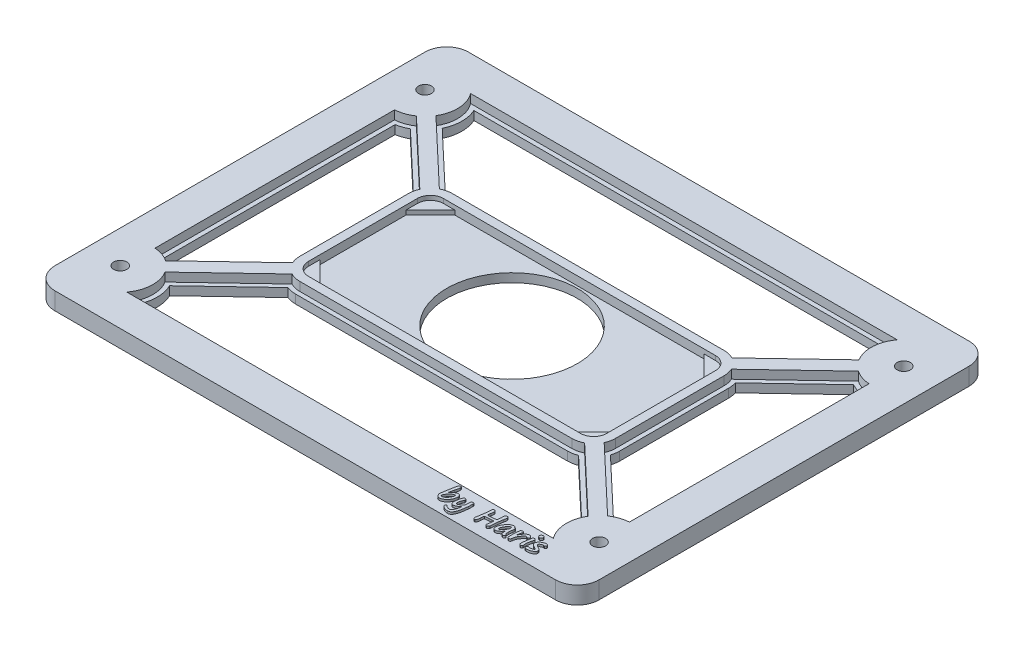
from build123d import *

# Parameters (mm, degrees)
SKETCH1_R           = 1.5
BOSS_EXTRUDE1_DEPTH = 4
CUT_EXTRUDE1_DEPTH  = 2
BOSS_EXTRUDE5_START = 1
BOSS_EXTRUDE5_DEPTH = 1
BOSS_EXTRUDE6_DEPTH = 2
CUT_EXTRUDE2_DEPTH  = 5
SKETCH9_R           = 15
CUT_EXTRUDE3_DEPTH  = 5
BOSS_EXTRUDE4_DEPTH = 0.5


with BuildPart() as part:
    # Sketch1 → Boss-Extrude1 (new body)
    with BuildSketch(Plane(origin=(0, 30, 0), x_dir=(1, 0, 0), z_dir=(0, 1, 0))):
        with BuildLine():
            Line((-57.5, 47.5), (57.5, 47.5))
            ThreePointArc((57.5, 47.5), (61.035533906, 46.035533906), (62.5, 42.5))
            Line((62.5, 42.5), (62.5, -42.5))
            ThreePointArc((62.5, -42.5), (61.035533906, -46.035533906), (57.5, -47.5))
            Line((57.5, -47.5), (-57.5, -47.5))
            ThreePointArc((-57.5, -47.5), (-61.035533906, -46.035533906), (-62.5, -42.5))
            Line((-62.5, -42.5), (-62.5, 42.5))
            ThreePointArc((-62.5, 42.5), (-61.035533906, 46.035533906), (-57.5, 47.5))
        make_face()
        with Locations((-55, -35)):
            Circle(SKETCH1_R, mode=Mode.SUBTRACT)
        with Locations((55, -35)):
            Circle(SKETCH1_R, mode=Mode.SUBTRACT)
        with Locations((55, 35)):
            Circle(SKETCH1_R, mode=Mode.SUBTRACT)
        with Locations((-55, 35)):
            Circle(SKETCH1_R, mode=Mode.SUBTRACT)
    extrude(amount=BOSS_EXTRUDE1_DEPTH)

    # Arduino_Cutout → Cut-Extrude1 (cut)
    # profile 1 of 2: a face of its own
    with BuildSketch(Plane(origin=(0, 34, 0), x_dir=(1, 0, 0), z_dir=(0, 1, 0))):
        with BuildLine():
            ThreePointArc((-54.5, -27.516685226), (-48.183662403, -31.871495284), (-49, -39.5))
            Line((-49, -39.5), (49, -39.5))
            ThreePointArc((49, -39.5), (48.183662403, -31.871495284), (54.5, -27.516685226))
            Line((54.5, -27.516685226), (54.5, 27.516685226))
            ThreePointArc((54.5, 27.516685226), (48.183662403, 31.871495284), (49, 39.5))
            Line((49, 39.5), (-49, 39.5))
            ThreePointArc((-49, 39.5), (-48.183662403, 31.871495284), (-54.5, 27.516685226))
            Line((-54.5, 27.516685226), (-54.5, -27.516685226))
        make_face()
        with BuildLine():
            ThreePointArc((-36.25, 12.5), (-34.785533906, 16.035533906), (-31.25, 17.5))
            Line((-31.25, 17.5), (31.25, 17.5))
            ThreePointArc((31.25, 17.5), (34.785533906, 16.035533906), (36.25, 12.5))
            Line((36.25, 12.5), (36.25, -12.5))
            ThreePointArc((36.25, -12.5), (34.785533906, -16.035533906), (31.25, -17.5))
            Line((31.25, -17.5), (-31.25, -17.5))
            ThreePointArc((-31.25, -17.5), (-34.785533906, -16.035533906), (-36.25, -12.5))
            Line((-36.25, -12.5), (-36.25, 12.5))
        make_face(mode=Mode.SUBTRACT)
    # profile 2 of 2: a face of its own
    with BuildSketch(Plane(origin=(0, 34, 0), x_dir=(1, 0, 0), z_dir=(0, 1, 0))):
        with BuildLine():
            Line((31.25, 15.5), (-31.25, 15.5))
            ThreePointArc((-31.25, 15.5), (-33.371320344, 14.621320344), (-34.25, 12.5))
            Line((-34.25, 12.5), (-34.25, -12.5))
            ThreePointArc((-34.25, -12.5), (-33.371320344, -14.621320344), (-31.25, -15.5))
            Line((-31.25, -15.5), (31.25, -15.5))
            ThreePointArc((31.25, -15.5), (33.371320344, -14.621320344), (34.25, -12.5))
            Line((34.25, -12.5), (34.25, 12.5))
            ThreePointArc((34.25, 12.5), (33.371320344, 14.621320344), (31.25, 15.5))
        make_face()
    extrude(amount=-CUT_EXTRUDE1_DEPTH, mode=Mode.SUBTRACT)


with BuildPart() as boss_extrude5_tool:
    # Sketch6 → Boss-Extrude5 (new body)
    with BuildSketch(Plane(origin=(0, 32, 0), x_dir=(1, 0, 0), z_dir=(0, 1, 0)).offset(BOSS_EXTRUDE5_START)):
        with BuildLine():
            Line((28.639875998, -15.5), (34.25, -9.889875998))
            Line((34.25, -9.889875998), (34.25, -12.5))
            ThreePointArc((34.25, -12.5), (33.371320344, -14.621320344), (31.25, -15.5))
            Line((31.25, -15.5), (28.639875998, -15.5))
        make_face()
        with BuildLine():
            Line((28.639875998, 15.5), (34.25, 9.889875998))
            Line((34.25, 9.889875998), (34.249992072, 12.506896859))
            ThreePointArc((34.249992072, 12.506896859), (33.368880533, 14.623757352), (31.25, 15.5))
            Line((31.25, 15.5), (28.639875998, 15.5))
        make_face()
        with BuildLine():
            Line((-34.25, 9.889875998), (-34.249992072, 12.506896859))
            ThreePointArc((-34.249992072, 12.506896859), (-33.368880533, 14.623757352), (-31.25, 15.5))
            Line((-31.25, 15.5), (-28.639875998, 15.5))
            Line((-28.639875998, 15.5), (-34.25, 9.889875998))
        make_face()
        with BuildLine():
            Line((-28.639875998, -15.5), (-34.25, -9.889875998))
            Line((-34.25, -9.889875998), (-34.25, -12.5))
            ThreePointArc((-34.25, -12.5), (-33.371320344, -14.621320344), (-31.25, -15.5))
            Line((-31.25, -15.5), (-28.639875998, -15.5))
        make_face()
    extrude(amount=-BOSS_EXTRUDE5_DEPTH)


with BuildPart() as part_1:
    add(part.part)


with BuildPart() as part_2:
    # Boss-Extrude5: joined with boss_extrude5_tool
    add(part_1.part.fuse(boss_extrude5_tool.part, tol=0.00001))

    # Sketch11 → Boss-Extrude6 (add)
    with BuildSketch(Plane(origin=(0, 32, 0), x_dir=(1, 0, 0), z_dir=(0, 1, 0))):
        Polygon((-50.770307362, 28.806479177), (-35.783638682, 14.608582533), (-33.600386983, 16.913125993), (-48.587055663, 31.111022637), align=None)
        Polygon((48.587055663, 31.111022637), (33.600386983, 16.913125993), (35.783638682, 14.608582533), (50.770307362, 28.806479177), align=None)
        Polygon((-48.587055663, -31.111022637), (-33.600386983, -16.913125993), (-35.783638682, -14.608582533), (-50.770307362, -28.806479177), align=None)
        Polygon((50.770307362, -28.806479177), (48.587055663, -31.111022637), (33.600386983, -16.913125993), (35.783638682, -14.608582533), align=None)
    extrude(amount=BOSS_EXTRUDE6_DEPTH)

    # Sketch8 → Cut-Extrude2 (cut)
    with BuildSketch(Plane(origin=(0, 32, 0), x_dir=(1, 0, 0), z_dir=(0, 1, 0))):
        with BuildLine():
            Line((47.342828007, -31.309780892), (33.400583169, -18.101338414))
            ThreePointArc((33.400583169, -18.101338414), (32.34361088, -18.399492795), (31.25, -18.5))
            Line((31.25, -18.5), (-31.25, -18.5))
            ThreePointArc((-31.25, -18.5), (-32.34361088, -18.399492795), (-33.400583169, -18.101338414))
            Line((-33.400583169, -18.101338414), (-47.342828007, -31.309780892))
            ThreePointArc((-47.342828007, -31.309780892), (-46.500648081, -34.895038331), (-47.254033308, -38.5))
            Line((-47.254033308, -38.5), (47.254033308, -38.5))
            ThreePointArc((47.254033308, -38.5), (46.500648081, -34.895038331), (47.342828007, -31.309780892))
        make_face()
        with BuildLine():
            Line((-50.901569002, -27.553332064), (-36.959324164, -14.344889586))
            ThreePointArc((-36.959324164, -14.344889586), (-37.176885564, -13.433824131), (-37.25, -12.5))
            Line((-37.25, -12.5), (-37.25, 12.5))
            ThreePointArc((-37.25, 12.5), (-37.176885564, 13.433824131), (-36.959324164, 14.344889586))
            Line((-36.959324164, 14.344889586), (-50.901569002, 27.553332064))
            ThreePointArc((-50.901569002, 27.553332064), (-52.163245467, 26.987333545), (-53.5, 26.633399735))
            Line((-53.5, 26.633399735), (-53.5, -26.633399735))
            ThreePointArc((-53.5, -26.633399735), (-52.163245467, -26.987333545), (-50.901569002, -27.553332064))
        make_face()
        with BuildLine():
            Line((36.959324164, -14.344889586), (50.901569002, -27.553332064))
            ThreePointArc((50.901569002, -27.553332064), (52.163245467, -26.987333545), (53.5, -26.633399735))
            Line((53.5, -26.633399735), (53.5, 26.633399735))
            ThreePointArc((53.5, 26.633399735), (52.163245467, 26.987333545), (50.901569002, 27.553332064))
            Line((50.901569002, 27.553332064), (36.959324164, 14.344889586))
            ThreePointArc((36.959324164, 14.344889586), (37.176885564, 13.433824131), (37.25, 12.5))
            Line((37.25, 12.5), (37.25, -12.5))
            ThreePointArc((37.25, -12.5), (37.176885564, -13.433824131), (36.959324164, -14.344889586))
        make_face()
        with BuildLine():
            Line((33.400583169, 18.101338414), (47.342828007, 31.309780892))
            ThreePointArc((47.342828007, 31.309780892), (46.500648081, 34.895038331), (47.254033308, 38.5))
            Line((47.254033308, 38.5), (-47.254033308, 38.5))
            ThreePointArc((-47.254033308, 38.5), (-46.500648081, 34.895038331), (-47.342828007, 31.309780892))
            Line((-47.342828007, 31.309780892), (-33.400583169, 18.101338414))
            ThreePointArc((-33.400583169, 18.101338414), (-32.34361088, 18.399492795), (-31.25, 18.5))
            Line((-31.25, 18.5), (31.25, 18.5))
            ThreePointArc((31.25, 18.5), (32.34361088, 18.399492795), (33.400583169, 18.101338414))
        make_face()
    extrude(amount=-CUT_EXTRUDE2_DEPTH, mode=Mode.SUBTRACT)

    # Sketch9 → Cut-Extrude3 (cut)
    with BuildSketch(Plane(origin=(0, 32, 0), x_dir=(1, 0, 0), z_dir=(0, 1, 0))):
        Circle(SKETCH9_R)
    extrude(amount=-CUT_EXTRUDE3_DEPTH, mode=Mode.SUBTRACT)

    # Sketch10 → Boss-Extrude4 (add)
    # profile 1 of 8: a face of its own
    with BuildSketch(Plane(origin=(0, 34, 0), x_dir=(1, 0, 0), z_dir=(0, 1, 0))):
        with BuildLine():
            add(Edge.make_bspline(
                [(49.600885149, -44.3125), (49.598414738, -44.299928318), (49.592958686, -44.272162991), (49.566149511, -44.233142498), (49.528530972, -44.191710756), (49.476437073, -44.148765787), (49.410404019, -44.10436106), (49.33055765, -44.058203849), (49.237509097, -44.009335869), (49.170193919, -43.977565196), (49.134538995, -43.960737179)],
                knots=[0, 0, 0, 0, 0.507015387, 1.119774364, 1.852261257, 2.745336137, 3.804359101, 5.02806584, 6.425851491, 8, 8, 8, 8], degree=3))
            add(Edge.make_bspline(
                [(49.134538995, -43.960737179), (49.090143126, -43.938687416), (49.004981761, -43.896390959), (48.883773364, -43.833848703), (48.776098618, -43.7718), (48.680924796, -43.712413993), (48.596916566, -43.657283855), (48.527027738, -43.602256048), (48.468665049, -43.550788471), (48.40941023, -43.485178224), (48.353246727, -43.401033022), (48.303239826, -43.29631763), (48.273063252, -43.186222343), (48.269392436, -43.111290342), (48.267551815, -43.073717949)],
                knots=[0, 0, 0, 0, 1.357483612, 2.603962024, 3.734367165, 4.759332248, 5.67627561, 6.483932287, 7.193417315, 7.804498922, 8.89998156, 9.950312991, 10.972246245, 12, 12, 12, 12], degree=3))
            add(Edge.make_bspline(
                [(48.267551815, -43.073717949), (48.26891372, -43.034034641), (48.271620995, -42.955149767), (48.298961543, -42.839540986), (48.340686141, -42.727342827), (48.400753571, -42.619803335), (48.477618596, -42.516326046), (48.569859033, -42.415615702), (48.68104549, -42.32088928), (48.804642587, -42.230238822), (48.936309157, -42.148951847), (49.066648267, -42.073838194), (49.19621673, -42.012610588), (49.322596478, -41.960487248), (49.447554652, -41.920984792), (49.570014843, -41.892999224), (49.690368995, -41.875105963), (49.769896436, -41.872890366), (49.809218482, -41.871794872)],
                knots=[0, 0, 0, 0, 0.895390549, 1.77991135, 2.670078063, 3.59406614, 4.552659087, 5.577920464, 6.673282169, 7.847996523, 9.038730168, 10.168527001, 11.245776762, 12.274762826, 13.256007705, 14.203398491, 15.11167709, 16, 16, 16, 16], degree=3))
            add(Edge.make_bspline(
                [(49.809218482, -41.871794872), (49.845108568, -41.872897806), (49.912616214, -41.874972375), (50.00697597, -41.893499496), (50.088054517, -41.922961315), (50.154519557, -41.96757029), (50.206338468, -42.024694583), (50.242161014, -42.094940613), (50.264145143, -42.176839273), (50.266373143, -42.235692163), (50.267551815, -42.266826923)],
                knots=[0, 0, 0, 0, 1.242964782, 2.337961117, 3.319847325, 4.213556405, 5.085560968, 5.963591422, 6.922685154, 8, 8, 8, 8], degree=3))
            add(Edge.make_bspline(
                [(50.267551815, -42.266826923), (50.266411273, -42.284136823), (50.264121313, -42.318891333), (50.242009709, -42.368463394), (50.208239796, -42.414789449), (50.163673122, -42.45609336), (50.114875037, -42.49019713), (50.068660038, -42.517901757), (50.024975978, -42.534049217), (49.996815083, -42.53707407), (49.983897969, -42.538461538)],
                knots=[0, 0, 0, 0, 0.97699526, 1.961593711, 3.02517148, 4.214528751, 5.387275293, 6.398091366, 7.265220967, 8, 8, 8, 8], degree=3))
            add(Edge.make_bspline(
                [(49.983897969, -42.538461538), (49.978005461, -42.538050229), (49.963952238, -42.537069285), (49.940160077, -42.531752585), (49.910492443, -42.523731779), (49.889046223, -42.516675982), (49.877327456, -42.512820513)],
                knots=[0, 0, 0, 0, 0.644110285, 1.536158334, 2.653693559, 4, 4, 4, 4], degree=3))
            add(Edge.make_bspline(
                [(49.877327456, -42.512820513), (49.855097302, -42.505412281), (49.816959696, -42.492702867), (49.777005457, -42.488805221), (49.760340277, -42.487179487)],
                knots=[0, 0, 0, 0, 1.165786607, 2, 2, 2, 2], degree=3))
            add(Edge.make_bspline(
                [(49.760340277, -42.487179487), (49.718790334, -42.489459403), (49.632591133, -42.4941893), (49.500749899, -42.525679235), (49.363449992, -42.577020367), (49.248542202, -42.634281733), (49.158717348, -42.686876549), (49.099638264, -42.730389143), (49.048382703, -42.774082105), (49.006799741, -42.820345466), (48.974165811, -42.86844488), (48.951709329, -42.918706436), (48.937029938, -42.970332436), (48.935160461, -43.005511431), (48.934218482, -43.023237179)],
                knots=[0, 0, 0, 0, 1.407632196, 2.920263242, 4.569449818, 6.366406994, 7.263471623, 8.092497508, 8.84932721, 9.541498029, 10.194082936, 10.809730306, 11.400255161, 12, 12, 12, 12], degree=3))
            add(Edge.make_bspline(
                [(48.934218482, -43.023237179), (48.935487046, -43.040772911), (48.938079602, -43.07661059), (48.958922713, -43.128675259), (48.991336707, -43.179532204), (49.028247316, -43.220166955), (49.066418787, -43.252617437), (49.102024616, -43.279333318), (49.144362366, -43.307996287), (49.194053736, -43.336621287), (49.249120409, -43.36950246), (49.311894031, -43.401702244), (49.380724944, -43.436325808), (49.429093031, -43.459237091), (49.454250533, -43.471153846)],
                knots=[0, 0, 0, 0, 0.875474263, 1.789201934, 2.768354177, 3.885199607, 4.52028356, 5.274241631, 6.112168998, 7.077351017, 8.143524944, 9.321499989, 10.606842341, 12, 12, 12, 12], degree=3))
            add(Edge.make_bspline(
                [(49.454250533, -43.471153846), (49.491451732, -43.489428746), (49.563074759, -43.524613193), (49.665072028, -43.577787162), (49.756115163, -43.631223272), (49.838837793, -43.681087733), (49.910278161, -43.731597005), (49.972855086, -43.779632251), (50.02514751, -43.826532646), (50.080136983, -43.886981728), (50.134895057, -43.964278587), (50.182053933, -44.062820687), (50.210565938, -44.166963323), (50.214353946, -44.238073739), (50.216269764, -44.274038462)],
                knots=[0, 0, 0, 0, 1.27151207, 2.448027098, 3.527344007, 4.509652556, 5.409792129, 6.20962247, 6.928887115, 7.561069154, 8.713601741, 9.820434099, 10.897665249, 12, 12, 12, 12], degree=3))
            add(Edge.make_bspline(
                [(50.216269764, -44.274038462), (50.21484821, -44.306793401), (50.212032257, -44.371677573), (50.185584843, -44.466593073), (50.143563822, -44.556938391), (50.084578401, -44.643004551), (50.008929243, -44.724303281), (49.916662384, -44.801019352), (49.808424034, -44.874119735), (49.685447321, -44.941519088), (49.55257224, -45.003137424), (49.413518673, -45.056791874), (49.270633157, -45.102479751), (49.123840765, -45.140392602), (48.972817851, -45.168992975), (48.817685289, -45.189731935), (48.65854471, -45.203072171), (48.550965047, -45.204438992), (48.496718482, -45.205128205)],
                knots=[0, 0, 0, 0, 0.737647673, 1.46120433, 2.205321861, 2.977507412, 3.80486027, 4.702969019, 5.67906423, 6.747245838, 7.863422134, 8.981386367, 10.10768365, 11.246246574, 12.399733899, 13.573273878, 14.776334184, 16, 16, 16, 16], degree=3))
            add(Edge.make_bspline(
                [(48.496718482, -45.205128205), (48.458711272, -45.204230738), (48.387346453, -45.202545595), (48.287921962, -45.185672383), (48.202839178, -45.159360766), (48.132700536, -45.120350603), (48.076790316, -45.06997701), (48.038481401, -45.006313126), (48.014271717, -44.932533716), (48.012215538, -44.879475876), (48.011141559, -44.851762821)],
                knots=[0, 0, 0, 0, 1.334045999, 2.504891855, 3.531580528, 4.447545952, 5.304102635, 6.142582961, 7.029837979, 8, 8, 8, 8], degree=3))
            add(Edge.make_bspline(
                [(48.011141559, -44.851762821), (48.012309589, -44.830769548), (48.01460819, -44.789456241), (48.03494043, -44.730267664), (48.067808628, -44.676237573), (48.112708161, -44.629181976), (48.164645549, -44.589491538), (48.221352502, -44.560380371), (48.281038788, -44.541356912), (48.322165225, -44.539431154), (48.342872328, -44.538461538)],
                knots=[0, 0, 0, 0, 0.997844758, 1.96368944, 2.945829432, 3.990302125, 5.044037246, 6.045769726, 7.016047788, 8, 8, 8, 8], degree=3))
            add(Edge.make_bspline(
                [(48.342872328, -44.538461538), (48.352501642, -44.538841404), (48.374520199, -44.53971001), (48.410795852, -44.545183442), (48.454531498, -44.551962124), (48.485546779, -44.559320218), (48.502327456, -44.563301282)],
                knots=[0, 0, 0, 0, 0.71493734, 1.634788241, 2.720312856, 4, 4, 4, 4], degree=3))
            add(Edge.make_bspline(
                [(48.502327456, -44.563301282), (48.536903279, -44.57111114), (48.602629934, -44.585957233), (48.669943667, -44.588526092), (48.701846687, -44.58974359)],
                knots=[0, 0, 0, 0, 1.05210962, 2, 2, 2, 2], degree=3))
            add(Edge.make_bspline(
                [(48.701846687, -44.58974359), (48.744625357, -44.588843645), (48.831779858, -44.587010157), (48.963489345, -44.570917142), (49.098406355, -44.545956612), (49.210917877, -44.517213693), (49.298941595, -44.489722126), (49.359643253, -44.468181465), (49.414978239, -44.446194541), (49.463274337, -44.420780897), (49.507234398, -44.396727827), (49.544010308, -44.36974362), (49.576207601, -44.343074332), (49.5928965, -44.322397564), (49.600885149, -44.3125)],
                knots=[0, 0, 0, 0, 1.599371766, 3.258456852, 4.955126155, 6.728569823, 7.597387722, 8.403040565, 9.137626545, 9.821128873, 10.443102821, 11.008610245, 11.525441154, 12, 12, 12, 12], degree=3))
        make_face()
    # profile 2 of 8: a face of its own
    with BuildSketch(Plane(origin=(0, 34, 0), x_dir=(1, 0, 0), z_dir=(0, 1, 0))):
        with BuildLine():
            add(Edge.make_bspline(
                [(48.216269764, -40.991987179), (48.214372496, -41.022468368), (48.210585454, -41.083310355), (48.176068009, -41.170720752), (48.120798987, -41.251368858), (48.047446101, -41.321497458), (47.96876427, -41.38135948), (47.891905727, -41.425883767), (47.820372128, -41.455467316), (47.773383814, -41.459610957), (47.751526174, -41.461538462)],
                knots=[0, 0, 0, 0, 1.020633984, 2.037236793, 3.10987328, 4.283687933, 5.430439738, 6.423201178, 7.266517617, 8, 8, 8, 8], degree=3))
            add(Edge.make_bspline(
                [(47.751526174, -41.461538462), (47.72539536, -41.460128857), (47.673503203, -41.457329578), (47.598813127, -41.430457291), (47.528594086, -41.388970531), (47.466472737, -41.331724909), (47.414429436, -41.26724985), (47.374518815, -41.200726664), (47.349675001, -41.133380026), (47.346171881, -41.087789964), (47.344474892, -41.065705128)],
                knots=[0, 0, 0, 0, 1.008582021, 2.002903408, 3.03704176, 4.15024144, 5.253498622, 6.236240751, 7.145595932, 8, 8, 8, 8], degree=3))
            add(Edge.make_bspline(
                [(47.344474892, -41.065705128), (47.346020261, -41.035386225), (47.348993405, -40.977055514), (47.371695916, -40.893700648), (47.411315132, -40.820434232), (47.464571817, -40.7557358), (47.533852963, -40.704102396), (47.616962774, -40.667013375), (47.712946101, -40.644372016), (47.781308228, -40.642178365), (47.817231303, -40.641025641)],
                knots=[0, 0, 0, 0, 1.012698287, 1.948335972, 2.858894459, 3.777859821, 4.72769898, 5.718440003, 6.801081042, 8, 8, 8, 8], degree=3))
            add(Edge.make_bspline(
                [(47.817231303, -40.641025641), (47.845647048, -40.642188502), (47.900514611, -40.644433854), (47.978679047, -40.66355521), (48.047721606, -40.697357189), (48.106816492, -40.742972305), (48.15463153, -40.797480996), (48.191368284, -40.857178712), (48.211858818, -40.923397046), (48.214784249, -40.968887436), (48.216269764, -40.991987179)],
                knots=[0, 0, 0, 0, 1.15044901, 2.221385842, 3.232987006, 4.243893231, 5.225346676, 6.157089074, 7.064181033, 8, 8, 8, 8], degree=3))
        make_face()
    # profile 3 of 8: a face of its own
    with BuildSketch(Plane(origin=(0, 34, 0), x_dir=(1, 0, 0), z_dir=(0, 1, 0))):
        with BuildLine():
            Line((46.9021672, -43.220352564), (46.9021672, -43.22275641))
            add(Edge.make_bspline(
                [(46.9021672, -43.22275641), (46.908443258, -43.183471891), (46.920274929, -43.109412415), (46.938934712, -43.005539363), (46.951594754, -42.91445241), (46.964615879, -42.83695057), (46.972326071, -42.772355048), (46.980860748, -42.721596625), (46.983663711, -42.683779709), (46.984978479, -42.662927289), (46.985500533, -42.654647436)],
                knots=[0, 0, 0, 0, 1.662261954, 3.133708889, 4.408996323, 5.504397162, 6.416666302, 7.126893436, 7.653316314, 8, 8, 8, 8], degree=3))
            add(Edge.make_bspline(
                [(46.985500533, -42.654647436), (46.986575632, -42.622262737), (46.988651188, -42.55974176), (47.004558157, -42.470075409), (47.031895887, -42.388595137), (47.070090678, -42.316728085), (47.117062048, -42.255367468), (47.175922079, -42.211540199), (47.243413339, -42.184147885), (47.291594045, -42.181072477), (47.316430021, -42.179487179)],
                knots=[0, 0, 0, 0, 1.202991705, 2.322461451, 3.370810698, 4.383210162, 5.33652186, 6.215922066, 7.080351462, 8, 8, 8, 8], degree=3))
            add(Edge.make_bspline(
                [(47.316430021, -42.179487179), (47.345355861, -42.180513208), (47.400229026, -42.182459613), (47.477595394, -42.198293555), (47.545123848, -42.225579308), (47.600950535, -42.26439938), (47.645842499, -42.30887167), (47.678922344, -42.356799026), (47.699842731, -42.408095143), (47.702247078, -42.443724022), (47.703449251, -42.461538462)],
                knots=[0, 0, 0, 0, 1.307088555, 2.47958523, 3.551682151, 4.576762227, 5.53323798, 6.394123767, 7.197061883, 8, 8, 8, 8], degree=3))
            add(Edge.make_bspline(
                [(47.703449251, -42.461538462), (47.70300486, -42.471692702), (47.702008488, -42.494459546), (47.698063497, -42.532550859), (47.689192365, -42.577440852), (47.680381562, -42.630115983), (47.665902868, -42.689136962), (47.650135527, -42.756031359), (47.630997858, -42.830059818), (47.616475777, -42.881704821), (47.608897969, -42.908653846)],
                knots=[0, 0, 0, 0, 0.532719886, 1.194412386, 2.004575007, 2.9299242, 3.992877743, 5.188099811, 6.532714389, 8, 8, 8, 8], degree=3))
            Line((47.608897969, -42.908653846), (47.592872328, -42.96875))
            add(Edge.make_bspline(
                [(47.592872328, -42.96875), (47.581466664, -43.011169622), (47.559211225, -43.093941414), (47.529779951, -43.21587911), (47.503408852, -43.331821783), (47.479812861, -43.44149261), (47.460763298, -43.545235418), (47.444320289, -43.642917222), (47.432486808, -43.734905195), (47.421070006, -43.846541358), (47.41196495, -43.974569655), (47.4029483, -44.11585262), (47.396693528, -44.241396583), (47.396054555, -44.319972525), (47.395756944, -44.356570513)],
                knots=[0, 0, 0, 0, 1.124403449, 2.194005634, 3.210751297, 4.168204317, 5.065338523, 5.910611901, 6.703550973, 7.43898777, 8.782998868, 9.988695154, 11.063202946, 12, 12, 12, 12], degree=3))
            add(Edge.make_bspline(
                [(47.395756944, -44.356570513), (47.396346442, -44.386516904), (47.397618469, -44.451135545), (47.410472919, -44.554752644), (47.427552211, -44.672456), (47.44396598, -44.755141879), (47.452647969, -44.798878205)],
                knots=[0, 0, 0, 0, 0.804287063, 1.735499181, 2.802202409, 4, 4, 4, 4], degree=3))
            add(Edge.make_bspline(
                [(47.452647969, -44.798878205), (47.455192758, -44.813797349), (47.459763913, -44.840596314), (47.460385323, -44.86776429), (47.46066079, -44.879807692)],
                knots=[0, 0, 0, 0, 1.113411905, 2, 2, 2, 2], degree=3))
            add(Edge.make_bspline(
                [(47.46066079, -44.879807692), (47.458942235, -44.891266506), (47.4549657, -44.917780856), (47.429056333, -44.956938607), (47.391887257, -45.001954447), (47.341894166, -45.049600047), (47.284815616, -45.095620684), (47.221297852, -45.128594919), (47.155734283, -45.150500455), (47.110671627, -45.152728427), (47.088064636, -45.153846154)],
                knots=[0, 0, 0, 0, 0.560105241, 1.296017723, 2.241022077, 3.421395522, 4.657704836, 5.806763445, 6.899699152, 8, 8, 8, 8], degree=3))
            add(Edge.make_bspline(
                [(47.088064636, -45.153846154), (47.059827037, -45.152200568), (47.005876528, -45.149056527), (46.930012706, -45.123742586), (46.866212365, -45.079599235), (46.814958539, -45.018105646), (46.775330692, -44.940376513), (46.748302098, -44.846063033), (46.731733865, -44.735356856), (46.730009352, -44.656048998), (46.729090277, -44.613782051)],
                knots=[0, 0, 0, 0, 0.921749575, 1.761086652, 2.577216848, 3.425721852, 4.351226527, 5.409093956, 6.619182387, 8, 8, 8, 8], degree=3))
            add(Edge.make_bspline(
                [(46.729090277, -44.613782051), (46.729279556, -44.574508995), (46.729668662, -44.493774289), (46.737005776, -44.369578056), (46.746188725, -44.239157822), (46.760149929, -44.102391011), (46.777682372, -43.959451785), (46.799426585, -43.810394765), (46.82515924, -43.655198425), (46.84482182, -43.549913069), (46.854891559, -43.49599359)],
                knots=[0, 0, 0, 0, 0.836611304, 1.719844915, 2.649940395, 3.6221856, 4.648486842, 5.718052099, 6.831352728, 8, 8, 8, 8], degree=3))
            add(Edge.make_bspline(
                [(46.854891559, -43.49599359), (46.86325992, -43.448733109), (46.879514031, -43.356937707), (46.894767107, -43.264970727), (46.9021672, -43.220352564)],
                knots=[0, 0, 0, 0, 1.029691688, 2, 2, 2, 2], degree=3))
        make_face()
    # profile 4 of 8: a face of its own
    with BuildSketch(Plane(origin=(0, 34, 0), x_dir=(1, 0, 0), z_dir=(0, 1, 0))):
        with BuildLine():
            Line((44.582455662, -43.650641026), (44.628930021, -43.563301282))
            add(Edge.make_bspline(
                [(44.628930021, -43.563301282), (44.656148483, -43.509463781), (44.709739598, -43.403461772), (44.79378596, -43.249733908), (44.879776606, -43.103702427), (44.966467719, -42.965076202), (45.056107686, -42.83528446), (45.145305422, -42.71202663), (45.23788265, -42.597538434), (45.330753036, -42.490791138), (45.423434487, -42.393447664), (45.517847595, -42.310126775), (45.610261931, -42.237971119), (45.703357752, -42.179881068), (45.795284389, -42.133363566), (45.887446806, -42.101212639), (45.978722389, -42.080740971), (46.039619173, -42.078183602), (46.069635149, -42.076923077)],
                knots=[0, 0, 0, 0, 1.342675018, 2.643626592, 3.898729047, 5.114308444, 6.281762812, 7.408988336, 8.49990255, 9.557440099, 10.558054005, 11.488670187, 12.357863998, 13.164464235, 13.92749628, 14.645720711, 15.332476827, 16, 16, 16, 16], degree=3))
            add(Edge.make_bspline(
                [(46.069635149, -42.076923077), (46.113871107, -42.078649544), (46.198772405, -42.081963123), (46.319912651, -42.110623591), (46.428156453, -42.157930027), (46.521057407, -42.224054855), (46.596812122, -42.301978047), (46.654755816, -42.388079086), (46.687889567, -42.483821358), (46.692374029, -42.549976904), (46.694635149, -42.583333333)],
                knots=[0, 0, 0, 0, 1.186417663, 2.277070584, 3.320513194, 4.339265769, 5.31808594, 6.225127969, 7.10508799, 8, 8, 8, 8], degree=3))
            add(Edge.make_bspline(
                [(46.694635149, -42.583333333), (46.693733965, -42.604190614), (46.691989199, -42.644572005), (46.682284603, -42.703299752), (46.66193256, -42.756427708), (46.637669077, -42.805393426), (46.604813194, -42.845635181), (46.565836874, -42.87630391), (46.519828966, -42.894556972), (46.486992699, -42.896464698), (46.470276174, -42.897435897)],
                knots=[0, 0, 0, 0, 1.164698742, 2.254951428, 3.301453464, 4.327924389, 5.291461902, 6.173673077, 7.070240241, 8, 8, 8, 8], degree=3))
            add(Edge.make_bspline(
                [(46.470276174, -42.897435897), (46.4428562, -42.895864538), (46.388093366, -42.892726239), (46.308520493, -42.868097919), (46.232168911, -42.829499419), (46.187830233, -42.792367106), (46.164987713, -42.773237179)],
                knots=[0, 0, 0, 0, 0.974791098, 1.946840685, 2.942247803, 4, 4, 4, 4], degree=3))
            add(Edge.make_bspline(
                [(46.164987713, -42.773237179), (46.149690127, -42.761198627), (46.121741129, -42.739203949), (46.080873705, -42.71305336), (46.044494085, -42.695808322), (46.020888363, -42.693388829), (46.010340277, -42.692307692)],
                knots=[0, 0, 0, 0, 1.315793817, 2.403981766, 3.286828117, 4, 4, 4, 4], degree=3))
            add(Edge.make_bspline(
                [(46.010340277, -42.692307692), (45.991628742, -42.694518562), (45.949610428, -42.699483256), (45.885625165, -42.733391152), (45.81384497, -42.783518906), (45.733651447, -42.853790389), (45.644962678, -42.943259132), (45.547717851, -43.052644373), (45.441131428, -43.181007521), (45.328936683, -43.326105612), (45.217202324, -43.482760348), (45.11604654, -43.64864964), (45.026351116, -43.819113201), (44.948038352, -43.994551388), (44.882565674, -44.174865522), (44.828574765, -44.360027809), (44.786629753, -44.550140072), (44.768077027, -44.679348431), (44.758737713, -44.744391026)],
                knots=[0, 0, 0, 0, 0.359954943, 0.808308856, 1.370007703, 2.047888506, 2.854689849, 3.793703275, 4.863047215, 6.064810855, 7.322499552, 8.56360192, 9.800450877, 11.026790245, 12.257601788, 13.488842491, 14.735900682, 16, 16, 16, 16], degree=3))
            add(Edge.make_bspline(
                [(44.758737713, -44.744391026), (44.752853804, -44.779532098), (44.741877052, -44.845089688), (44.714787844, -44.93506333), (44.67609498, -45.007540394), (44.628802959, -45.065158893), (44.569784934, -45.104729399), (44.504110573, -45.134259979), (44.428619461, -45.151006123), (44.375539066, -45.152868626), (44.347680021, -45.153846154)],
                knots=[0, 0, 0, 0, 1.313965477, 2.451274329, 3.447542989, 4.328112894, 5.169965353, 6.043284913, 6.973025463, 8, 8, 8, 8], degree=3))
            add(Edge.make_bspline(
                [(44.347680021, -45.153846154), (44.332650776, -45.153344306), (44.303272856, -45.152363336), (44.26108852, -45.141319751), (44.222155825, -45.12466717), (44.186797424, -45.100497065), (44.154791441, -45.070009175), (44.126515135, -45.032604833), (44.102611782, -44.988281945), (44.080696692, -44.937472802), (44.062770647, -44.878488016), (44.046787721, -44.811592722), (44.033181396, -44.736447391), (44.023376141, -44.652628508), (44.014377761, -44.560492846), (44.007916397, -44.459484477), (44.005235876, -44.349907132), (44.004375358, -44.274039063), (44.003930021, -44.234775641)],
                knots=[0, 0, 0, 0, 0.667675349, 1.305116434, 1.928195861, 2.545001561, 3.201138611, 3.888540112, 4.623183241, 5.438316745, 6.348537893, 7.363865542, 8.499892598, 9.746335155, 11.120211981, 12.621681073, 14.251644417, 16, 16, 16, 16], degree=3))
            add(Edge.make_bspline(
                [(44.003930021, -44.234775641), (44.004165719, -44.198450633), (44.004673525, -44.120189339), (44.006199182, -43.993845246), (44.009472214, -43.850143882), (44.012663132, -43.748395076), (44.014346687, -43.694711538)],
                knots=[0, 0, 0, 0, 0.806963427, 1.7385819, 2.806856532, 4, 4, 4, 4], degree=3))
            add(Edge.make_bspline(
                [(44.014346687, -43.694711538), (44.016689978, -43.638335407), (44.021635918, -43.519343387), (44.036334791, -43.332183206), (44.053242909, -43.126924443), (44.068761178, -42.984476365), (44.076846687, -42.91025641)],
                knots=[0, 0, 0, 0, 0.860167471, 1.81553902, 2.861826733, 4, 4, 4, 4], degree=3))
            add(Edge.make_bspline(
                [(44.076846687, -42.91025641), (44.078963414, -42.891290772), (44.082958037, -42.855499379), (44.088890382, -42.805078037), (44.092698556, -42.760958456), (44.095011828, -42.733707314), (44.096077456, -42.721153846)],
                knots=[0, 0, 0, 0, 1.204707188, 2.273487868, 3.204667671, 4, 4, 4, 4], degree=3))
            add(Edge.make_bspline(
                [(44.096077456, -42.721153846), (44.100262108, -42.680016252), (44.107960034, -42.604341104), (44.119657696, -42.501478361), (44.134324923, -42.419725038), (44.148900788, -42.35495724), (44.170905019, -42.301102181), (44.203631545, -42.25351553), (44.244517108, -42.206630952), (44.29545633, -42.163541439), (44.352537223, -42.125404734), (44.414535241, -42.096794404), (44.480110693, -42.080276573), (44.524673468, -42.078049053), (44.547199251, -42.076923077)],
                knots=[0, 0, 0, 0, 1.682885646, 3.095772139, 4.21087139, 5.062363314, 5.793118134, 6.561848993, 7.401323855, 8.31854269, 9.268163237, 10.187504894, 11.083812183, 12, 12, 12, 12], degree=3))
            add(Edge.make_bspline(
                [(44.547199251, -42.076923077), (44.570274392, -42.077937152), (44.614107774, -42.079863481), (44.675330025, -42.095906504), (44.728094943, -42.122860991), (44.770088248, -42.161253726), (44.80348851, -42.204658184), (44.827164109, -42.251521253), (44.842536408, -42.300054883), (44.844364637, -42.333489884), (44.845276174, -42.350160256)],
                knots=[0, 0, 0, 0, 1.224001027, 2.325104054, 3.3339825, 4.338863789, 5.320548098, 6.227764901, 7.116380495, 8, 8, 8, 8], degree=3))
            add(Edge.make_bspline(
                [(44.845276174, -42.350160256), (44.8449385, -42.36246083), (44.844179656, -42.390103433), (44.837985814, -42.435572103), (44.828140113, -42.489784323), (44.814362216, -42.552489584), (44.797453156, -42.624391947), (44.776703985, -42.704829125), (44.751695624, -42.794006949), (44.733190192, -42.856063682), (44.723481303, -42.888621795)],
                knots=[0, 0, 0, 0, 0.533426491, 1.198748629, 1.987314177, 2.923502543, 3.982906841, 5.191169109, 6.526344709, 8, 8, 8, 8], degree=3))
            add(Edge.make_bspline(
                [(44.723481303, -42.888621795), (44.716331391, -42.913138541), (44.701417641, -42.964277165), (44.682376879, -43.045017896), (44.665854056, -43.132835396), (44.655787345, -43.193623031), (44.650564636, -43.225160256)],
                knots=[0, 0, 0, 0, 0.889120287, 1.854584907, 2.886937431, 4, 4, 4, 4], degree=3))
            Line((44.650564636, -43.225160256), (44.582455662, -43.650641026))
        make_face()
    # profile 5 of 8: a face of its own
    with BuildSketch(Plane(origin=(0, 34, 0), x_dir=(1, 0, 0), z_dir=(0, 1, 0))):
        with BuildLine():
            add(Edge.make_bspline(
                [(42.523962072, -44.084134615), (42.494795024, -44.123293974), (42.437694145, -44.199956986), (42.350398282, -44.309575079), (42.263843564, -44.41218475), (42.176303799, -44.505909485), (42.09099217, -44.594351117), (42.004358181, -44.672913011), (41.919139836, -44.745322993), (41.833411685, -44.808996258), (41.748716319, -44.866266759), (41.664089951, -44.915469585), (41.579979387, -44.957093324), (41.496436045, -44.992088339), (41.412794548, -45.018765795), (41.329317038, -45.036938348), (41.246519269, -45.048760835), (41.191468229, -45.050446621), (41.164186431, -45.051282051)],
                knots=[0, 0, 0, 0, 1.356023357, 2.654712406, 3.891393304, 5.083024518, 6.216069908, 7.302884312, 8.329608252, 9.320661259, 10.267066465, 11.16786372, 12.037043053, 12.871862459, 13.681246504, 14.471364928, 15.242450052, 16, 16, 16, 16], degree=3))
            add(Edge.make_bspline(
                [(41.164186431, -45.051282051), (41.144391837, -45.050614457), (41.105406565, -45.049299636), (41.047819086, -45.040389483), (40.992591531, -45.024967653), (40.939117695, -45.004300272), (40.88850734, -44.976360368), (40.839180749, -44.943734506), (40.792871316, -44.903762069), (40.748106655, -44.859516749), (40.707610994, -44.810102068), (40.671766951, -44.756894672), (40.642745852, -44.699760403), (40.616926296, -44.640214275), (40.599155341, -44.576447383), (40.585578539, -44.509785721), (40.576123895, -44.439903102), (40.575541029, -44.392125762), (40.575244123, -44.367788462)],
                knots=[0, 0, 0, 0, 0.945321612, 1.861802311, 2.774725229, 3.679591997, 4.59278223, 5.53032613, 6.49885814, 7.509081362, 8.53314226, 9.544974888, 10.566251385, 11.589676516, 12.639239866, 13.719966986, 14.838573882, 16, 16, 16, 16], degree=3))
            add(Edge.make_bspline(
                [(40.575244123, -44.367788462), (40.576994402, -44.307293364), (40.580539916, -44.18474933), (40.613278537, -44.000233671), (40.662854179, -43.812670316), (40.733482895, -43.622226102), (40.823626412, -43.428839373), (40.934362001, -43.232932619), (41.064477564, -43.034096071), (41.211837086, -42.837487639), (41.36691762, -42.650037764), (41.527174329, -42.483858876), (41.688636316, -42.344040458), (41.84888521, -42.227280293), (42.011608685, -42.138425181), (42.173913353, -42.072975878), (42.337793601, -42.033508016), (42.447372958, -42.028242969), (42.501526174, -42.025641026)],
                knots=[0, 0, 0, 0, 0.889196787, 1.801232913, 2.748537119, 3.740458641, 4.784595262, 5.884038581, 7.047887778, 8.277659922, 9.496557421, 10.624628729, 11.669149669, 12.63513973, 13.53538715, 14.389012883, 15.203863436, 16, 16, 16, 16], degree=3))
            add(Edge.make_bspline(
                [(42.501526174, -42.025641026), (42.52804507, -42.026458182), (42.578842329, -42.028023454), (42.651508501, -42.042876498), (42.717187013, -42.066718489), (42.77584571, -42.100854468), (42.827199917, -42.144831177), (42.870623157, -42.198947), (42.908313908, -42.261748889), (42.925389957, -42.308936674), (42.934218482, -42.333333333)],
                knots=[0, 0, 0, 0, 1.109020399, 2.124341774, 3.090185179, 4.022232803, 4.950045201, 5.903576897, 6.916123743, 8, 8, 8, 8], degree=3))
            add(Edge.make_bspline(
                [(42.934218482, -42.333333333), (42.958298043, -42.334084249), (43.003547401, -42.33549534), (43.066941521, -42.346251588), (43.120731399, -42.36543051), (43.165655833, -42.391962892), (43.200273482, -42.427454605), (43.225021973, -42.470666352), (43.239514061, -42.521531318), (43.241086057, -42.557862346), (43.24191079, -42.576923077)],
                knots=[0, 0, 0, 0, 1.290339358, 2.424754674, 3.43007345, 4.33600111, 5.196452301, 6.055831131, 6.980010171, 8, 8, 8, 8], degree=3))
            add(Edge.make_bspline(
                [(43.24191079, -42.576923077), (43.241715706, -42.587608738), (43.241291004, -42.610871674), (43.23892239, -42.648865756), (43.233490401, -42.692558856), (43.228571609, -42.742393501), (43.219680857, -42.79776469), (43.211618181, -42.859387413), (43.1999382, -42.926591116), (43.191706976, -42.973293274), (43.18742361, -42.997596154)],
                knots=[0, 0, 0, 0, 0.604092695, 1.315123946, 2.150418371, 3.092416672, 4.145034518, 5.319352214, 6.605043841, 8, 8, 8, 8], degree=3))
            add(Edge.make_bspline(
                [(43.18742361, -42.997596154), (43.179488556, -43.043773483), (43.164004339, -43.133882476), (43.144590205, -43.265702247), (43.126097647, -43.389997326), (43.113119671, -43.50741252), (43.101092704, -43.61762344), (43.094543104, -43.720841289), (43.089015833, -43.81671538), (43.088374143, -43.878197672), (43.088064636, -43.907852564)],
                knots=[0, 0, 0, 0, 1.226639916, 2.393626719, 3.488379711, 4.516231462, 5.48619605, 6.390464658, 7.223669214, 8, 8, 8, 8], degree=3))
            add(Edge.make_bspline(
                [(43.088064636, -43.907852564), (43.088174498, -43.93616828), (43.08838701, -43.99094077), (43.091233265, -44.06971697), (43.093581239, -44.141940301), (43.099958587, -44.207298382), (43.105456776, -44.266543566), (43.114722264, -44.319067128), (43.123803666, -44.365255777), (43.138593808, -44.415485552), (43.156961334, -44.467872654), (43.176363294, -44.520883549), (43.191400655, -44.562003659), (43.204187638, -44.593878811), (43.222705452, -44.620308455), (43.251774215, -44.642285104), (43.290446348, -44.666040828), (43.320523358, -44.680341783), (43.337263354, -44.688301282)],
                knots=[0, 0, 0, 0, 1.567397175, 3.031893793, 4.36395717, 5.566095927, 6.666643326, 7.655987536, 8.517270385, 9.270781815, 10.551979075, 11.590380805, 12.395103772, 12.977608867, 13.486388503, 14.158465495, 14.97505499, 16, 16, 16, 16], degree=3))
            add(Edge.make_bspline(
                [(43.337263354, -44.688301282), (43.353811347, -44.696856276), (43.384678931, -44.712814224), (43.420709576, -44.747177222), (43.442695027, -44.787882787), (43.445585478, -44.817058974), (43.447038995, -44.831730769)],
                knots=[0, 0, 0, 0, 1.165299696, 2.173676752, 3.081599004, 4, 4, 4, 4], degree=3))
            add(Edge.make_bspline(
                [(43.447038995, -44.831730769), (43.445416301, -44.853919738), (43.442160634, -44.898438241), (43.412789695, -44.961430358), (43.365000623, -45.016884455), (43.302107999, -45.063909648), (43.230639429, -45.103124174), (43.155105912, -45.131901801), (43.078040656, -45.150851329), (43.025939276, -45.152848774), (42.99992361, -45.153846154)],
                knots=[0, 0, 0, 0, 0.878065885, 1.761694263, 2.703389782, 3.762676792, 4.86464712, 5.932934182, 6.967856617, 8, 8, 8, 8], degree=3))
            add(Edge.make_bspline(
                [(42.99992361, -45.153846154), (42.978752764, -45.153184237), (42.937333267, -45.151889235), (42.877631829, -45.138615261), (42.822286224, -45.117555694), (42.771093179, -45.088571927), (42.724828635, -45.050252696), (42.684105818, -45.002887241), (42.64675755, -44.948402481), (42.616249404, -44.884660624), (42.587400793, -44.814176629), (42.565821506, -44.734078286), (42.547513204, -44.646043852), (42.533100351, -44.549754941), (42.523695384, -44.445153149), (42.519071194, -44.332314709), (42.519274857, -44.210964985), (42.522363243, -44.127396993), (42.523962072, -44.084134615)],
                knots=[0, 0, 0, 0, 0.773825149, 1.513942755, 2.225624096, 2.934951653, 3.657163171, 4.412173457, 5.21473361, 6.067239236, 6.993044523, 7.99880155, 9.097382658, 10.28358984, 11.559832941, 12.939453337, 14.415583287, 16, 16, 16, 16], degree=3))
        make_face()
        with BuildLine():
            add(Edge.make_bspline(
                [(42.379731303, -42.58974359), (42.355993296, -42.591869053), (42.305446244, -42.596394956), (42.22878168, -42.62748996), (42.147943493, -42.675367364), (42.062591018, -42.742987914), (41.971683883, -42.82782284), (41.876376677, -42.932435062), (41.775757096, -43.055066265), (41.673286108, -43.192529172), (41.573728398, -43.335309507), (41.48633657, -43.477697377), (41.411186415, -43.613711916), (41.349922458, -43.74451797), (41.301901613, -43.869747599), (41.26834211, -43.989661738), (41.245539432, -44.103834936), (41.243093734, -44.178587144), (41.24191079, -44.21474359)],
                knots=[0, 0, 0, 0, 0.54744847, 1.165721596, 1.886720474, 2.712783077, 3.672303947, 4.754109618, 5.975833812, 7.331904961, 8.710001505, 9.991304757, 11.185730027, 12.29430067, 13.322352334, 14.276572328, 15.166405625, 16, 16, 16, 16], degree=3))
            add(Edge.make_bspline(
                [(41.24191079, -44.21474359), (41.242258549, -44.232110578), (41.242906966, -44.264492311), (41.246523063, -44.30956833), (41.253536717, -44.347788435), (41.26362698, -44.379179634), (41.276516824, -44.403989581), (41.291697755, -44.422779519), (41.311425604, -44.434398542), (41.325901229, -44.435392408), (41.333256944, -44.435897436)],
                knots=[0, 0, 0, 0, 1.590964957, 2.966444131, 4.137181585, 5.142920197, 5.974723591, 6.685888184, 7.332240758, 8, 8, 8, 8], degree=3))
            add(Edge.make_bspline(
                [(41.333256944, -44.435897436), (41.360692856, -44.434060616), (41.418073641, -44.430219001), (41.505061393, -44.401212658), (41.596063419, -44.356358888), (41.691484262, -44.293808611), (41.790886979, -44.213466798), (41.894938617, -44.115919254), (42.003755696, -44.001091557), (42.113431116, -43.872042383), (42.219056409, -43.736994612), (42.314336199, -43.602894798), (42.39354665, -43.471779515), (42.46017108, -43.346314416), (42.511292867, -43.224563222), (42.547579026, -43.107343409), (42.570796735, -42.994236756), (42.573787781, -42.919973112), (42.575244123, -42.883814103)],
                knots=[0, 0, 0, 0, 0.626637245, 1.310579262, 2.078207989, 2.943963213, 3.913149235, 4.997932261, 6.203331759, 7.529025684, 8.869385306, 10.123374048, 11.288242283, 12.370132458, 13.369509429, 14.302688267, 15.173577979, 16, 16, 16, 16], degree=3))
            add(Edge.make_bspline(
                [(42.575244123, -42.883814103), (42.574450456, -42.862405245), (42.572930528, -42.821405773), (42.562209339, -42.76330114), (42.542517516, -42.712458113), (42.516486827, -42.669205583), (42.485286382, -42.635183723), (42.452638549, -42.608769085), (42.416900123, -42.592565902), (42.391895059, -42.590667211), (42.379731303, -42.58974359)],
                knots=[0, 0, 0, 0, 1.321464863, 2.530698423, 3.626747974, 4.670074656, 5.627123282, 6.461426355, 7.251558174, 8, 8, 8, 8], degree=3))
        make_face(mode=Mode.SUBTRACT)
    # profile 6 of 8: a face of its own
    with BuildSketch(Plane(origin=(0, 34, 0), x_dir=(1, 0, 0), z_dir=(0, 1, 0))):
        with BuildLine():
            add(Edge.make_bspline(
                [(37.191430021, -43.528044872), (37.185530793, -43.542904231), (37.171975348, -43.577048569), (37.156651104, -43.638112871), (37.142901283, -43.714754702), (37.129319831, -43.80749919), (37.116619149, -43.91623224), (37.105605788, -44.041290172), (37.096253606, -44.182371536), (37.090889754, -44.281777782), (37.088064636, -44.334134615)],
                knots=[0, 0, 0, 0, 0.470173412, 1.080380323, 1.848223949, 2.762106854, 3.838627575, 5.069930962, 6.456745515, 8, 8, 8, 8], degree=3))
            add(Edge.make_bspline(
                [(37.088064636, -44.334134615), (37.08497071, -44.396178226), (37.079044158, -44.515025494), (37.056039471, -44.684978813), (37.025172574, -44.839460959), (36.988663725, -44.956670169), (36.954962652, -45.039877959), (36.929246744, -45.093383484), (36.899565608, -45.137370038), (36.870776338, -45.17575198), (36.837059671, -45.203403755), (36.80327671, -45.225615476), (36.766236069, -45.238009909), (36.740922966, -45.239593989), (36.728288995, -45.240384615)],
                knots=[0, 0, 0, 0, 2.145391341, 4.109591578, 5.919430463, 7.58305138, 8.34048742, 9.02143179, 9.628035169, 10.172806298, 10.670268968, 11.126103902, 11.563831522, 12, 12, 12, 12], degree=3))
            add(Edge.make_bspline(
                [(36.728288995, -45.240384615), (36.700380327, -45.239309742), (36.646187848, -45.237222574), (36.568333639, -45.216399242), (36.497775267, -45.182250821), (36.43460295, -45.135844135), (36.381965163, -45.075699309), (36.345298213, -45.001712253), (36.322088235, -44.91644762), (36.319955099, -44.855666241), (36.318833867, -44.823717949)],
                knots=[0, 0, 0, 0, 1.014780429, 1.970479781, 2.91035082, 3.855994616, 4.807823719, 5.791150975, 6.838970845, 8, 8, 8, 8], degree=3))
            add(Edge.make_bspline(
                [(36.318833867, -44.823717949), (36.319918765, -44.791092279), (36.322283793, -44.719969808), (36.338130664, -44.605247907), (36.362149027, -44.473707228), (36.384082797, -44.381048138), (36.395756944, -44.331730769)],
                knots=[0, 0, 0, 0, 0.784625009, 1.710446688, 2.781395928, 4, 4, 4, 4], degree=3))
            add(Edge.make_bspline(
                [(36.395756944, -44.331730769), (36.403070669, -44.300236745), (36.418596304, -44.233380982), (36.441085465, -44.12658478), (36.463236017, -44.00765162), (36.48555462, -43.876433624), (36.508896887, -43.733323023), (36.531978263, -43.578106537), (36.555077588, -43.410845251), (36.579258285, -43.231675912), (36.603239557, -43.040154877), (36.627044807, -42.836300789), (36.652089427, -42.620540356), (36.676607194, -42.392642583), (36.702585345, -42.152855193), (36.728036789, -41.900962254), (36.75359708, -41.636771521), (36.77077755, -41.456732748), (36.779571046, -41.364583333)],
                knots=[0, 0, 0, 0, 0.518410896, 1.100486719, 1.749768325, 2.458061943, 3.234648661, 4.074710869, 4.974114753, 5.941989782, 6.973571058, 8.06892087, 9.232828292, 10.456320364, 11.744140183, 13.100112647, 14.515747938, 16, 16, 16, 16], degree=3))
            add(Edge.make_bspline(
                [(36.779571046, -41.364583333), (36.782923402, -41.349140212), (36.78983681, -41.317292582), (36.813530857, -41.27217171), (36.846616087, -41.228287152), (36.887637469, -41.186137231), (36.935503233, -41.150538667), (36.985217962, -41.121815174), (37.037763003, -41.106355364), (37.073023177, -41.103818995), (37.090468482, -41.102564103)],
                knots=[0, 0, 0, 0, 0.8673115, 1.788616082, 2.777481443, 3.89087305, 5.015102724, 6.055610188, 7.037994718, 8, 8, 8, 8], degree=3))
            add(Edge.make_bspline(
                [(37.090468482, -41.102564103), (37.118380418, -41.103872541), (37.171598018, -41.106367244), (37.246059001, -41.127143771), (37.309201036, -41.162690493), (37.361531194, -41.212004762), (37.399883868, -41.277018207), (37.42781026, -41.354402895), (37.444384264, -41.445628094), (37.446115701, -41.510878258), (37.447038995, -41.545673077)],
                knots=[0, 0, 0, 0, 1.030592645, 1.964953962, 2.827045709, 3.685965907, 4.590162308, 5.589691531, 6.714696758, 8, 8, 8, 8], degree=3))
            add(Edge.make_bspline(
                [(37.447038995, -41.545673077), (37.446984171, -41.563576413), (37.44686703, -41.601829647), (37.442020002, -41.662960299), (37.436575891, -41.731341065), (37.429650113, -41.807304916), (37.418615239, -41.890246413), (37.406940172, -41.980874858), (37.392397586, -42.078627012), (37.381416179, -42.146113704), (37.375724892, -42.181089744)],
                knots=[0, 0, 0, 0, 0.671182184, 1.43408406, 2.298354383, 3.244213889, 4.294039783, 5.435836213, 6.671081773, 8, 8, 8, 8], degree=3))
            add(Edge.make_bspline(
                [(37.375724892, -42.181089744), (37.369234445, -42.221408655), (37.356734475, -42.29905895), (37.339953334, -42.411515271), (37.325122245, -42.515339977), (37.314405331, -42.61109402), (37.304261584, -42.698060904), (37.297659576, -42.776888189), (37.294676486, -42.847201286), (37.293664791, -42.891291272), (37.293192841, -42.911858974)],
                knots=[0, 0, 0, 0, 1.331516686, 2.564371453, 3.707300402, 4.750780271, 5.705761351, 6.562050707, 7.329205645, 8, 8, 8, 8], degree=3))
            add(Edge.make_bspline(
                [(37.293192841, -42.911858974), (37.299722483, -42.915961317), (37.317696454, -42.927253724), (37.358298943, -42.933040491), (37.415573028, -42.937853678), (37.460071112, -42.938138509), (37.485500533, -42.938301282)],
                knots=[0, 0, 0, 0, 0.467525663, 1.286945393, 2.449564505, 4, 4, 4, 4], degree=3))
            add(Edge.make_bspline(
                [(37.485500533, -42.938301282), (37.518089635, -42.938214959), (37.586755062, -42.938033075), (37.694633029, -42.933961988), (37.812501836, -42.930961332), (37.939818342, -42.922604008), (38.076916369, -42.915367297), (38.223508951, -42.904461809), (38.380026511, -42.892454807), (38.541408304, -42.879465223), (38.698035145, -42.865108785), (38.839621507, -42.84836294), (38.961737228, -42.830812027), (39.064086814, -42.813282327), (39.146575087, -42.793433036), (39.209312253, -42.773218052), (39.254137897, -42.753180658), (39.282362993, -42.726881726), (39.294573538, -42.692566916), (39.308375226, -42.652508966), (39.321749613, -42.600440085), (39.335020977, -42.537592801), (39.348609537, -42.463565021), (39.362235939, -42.378344545), (39.375377409, -42.281808625), (39.3952339, -42.137022341), (39.416763688, -41.945381422), (39.433630149, -41.707457659), (39.44571363, -41.462731749), (39.446593563, -41.297024025), (39.447038995, -41.213141026)],
                knots=[0, 0, 0, 0, 0.81737967, 1.722223718, 2.707635668, 3.774578528, 4.922168826, 6.151286787, 7.461569864, 8.85973494, 10.212359144, 11.40650677, 12.435458429, 13.306742425, 14.010328897, 14.56116546, 14.959665461, 15.234431092, 15.49836505, 15.858527418, 16.302171008, 16.843555739, 17.470354135, 18.189587588, 19.008201868, 19.914012696, 21.855373767, 23.843927663, 25.896152309, 28, 28, 28, 28], degree=3))
            add(Edge.make_bspline(
                [(39.447038995, -41.213141026), (39.448691147, -41.199301917), (39.452355414, -41.168608492), (39.47726949, -41.122203156), (39.513395161, -41.070337043), (39.562359535, -41.015982482), (39.618197514, -40.964479513), (39.680154104, -40.925669498), (39.744976722, -40.901454085), (39.789525243, -40.898768172), (39.811622328, -40.897435897)],
                knots=[0, 0, 0, 0, 0.643669039, 1.427577989, 2.410170029, 3.589935358, 4.822342391, 5.932975698, 6.974708639, 8, 8, 8, 8], degree=3))
            add(Edge.make_bspline(
                [(39.811622328, -40.897435897), (39.836115523, -40.898397254), (39.883673434, -40.900263899), (39.951128158, -40.92277191), (40.01258386, -40.956651803), (40.065572318, -41.004153339), (40.108817976, -41.059603084), (40.142629029, -41.119937788), (40.1610541, -41.185906762), (40.163670473, -41.231202044), (40.164987713, -41.25400641)],
                knots=[0, 0, 0, 0, 1.051026579, 2.040755791, 3.029749119, 4.05688923, 5.08112553, 6.048945192, 7.017721805, 8, 8, 8, 8], degree=3))
            add(Edge.make_bspline(
                [(40.164987713, -41.25400641), (40.164686936, -41.272715268), (40.164032685, -41.313410953), (40.157548512, -41.379637055), (40.14894097, -41.456059054), (40.136603869, -41.542844721), (40.121589192, -41.639893202), (40.101902909, -41.747152474), (40.079783302, -41.865062081), (40.062585467, -41.946880403), (40.053609508, -41.989583333)],
                knots=[0, 0, 0, 0, 0.602644332, 1.310877699, 2.142429914, 3.080766196, 4.134814288, 5.306326962, 6.594107881, 8, 8, 8, 8], degree=3))
            add(Edge.make_bspline(
                [(40.053609508, -41.989583333), (40.042962822, -42.041087409), (40.020999213, -42.147337882), (39.991537614, -42.312749198), (39.963888931, -42.488622898), (39.936527394, -42.675050001), (39.910063965, -42.871877326), (39.885200407, -43.079696087), (39.862402988, -43.29799844), (39.840127632, -43.521795048), (39.821078819, -43.740904965), (39.803003708, -43.945173243), (39.788737908, -44.129774757), (39.776720884, -44.29483902), (39.766675524, -44.440638763), (39.760496553, -44.567010368), (39.756083648, -44.673582214), (39.755149708, -44.737977707), (39.754731303, -44.766826923)],
                knots=[0, 0, 0, 0, 0.902847381, 1.862531448, 2.883980482, 3.959129865, 5.097214141, 6.293279679, 7.552105666, 8.865203849, 10.154191315, 11.327782739, 12.385623257, 13.33269299, 14.169027059, 14.89443034, 15.504704192, 16, 16, 16, 16], degree=3))
            add(Edge.make_bspline(
                [(39.754731303, -44.766826923), (39.752922052, -44.791347742), (39.749227415, -44.84142123), (39.721421544, -44.915369003), (39.676926632, -44.98794456), (39.618699677, -45.056851914), (39.554371483, -45.117001276), (39.490977956, -45.162747537), (39.430694297, -45.19364891), (39.389898374, -45.197655213), (39.3709172, -45.199519231)],
                knots=[0, 0, 0, 0, 0.948574861, 1.937066295, 3.02322237, 4.235595908, 5.421850631, 6.423953326, 7.266710641, 8, 8, 8, 8], degree=3))
            add(Edge.make_bspline(
                [(39.3709172, -45.199519231), (39.351557924, -45.198439631), (39.312384141, -45.196255046), (39.254802091, -45.178044649), (39.197739017, -45.15052709), (39.143941018, -45.112046371), (39.096244151, -45.065063957), (39.062223324, -45.009110914), (39.039589832, -44.947194354), (39.037737194, -44.903251445), (39.036782585, -44.880608974)],
                knots=[0, 0, 0, 0, 0.908985123, 1.839344895, 2.817199625, 3.880604302, 4.937978492, 5.942279414, 6.939717961, 8, 8, 8, 8], degree=3))
            add(Edge.make_bspline(
                [(39.036782585, -44.880608974), (39.037211965, -44.870718376), (39.038282465, -44.846059871), (39.043719905, -44.802006115), (39.051576995, -44.744024578), (39.063125325, -44.672213339), (39.077561539, -44.58647834), (39.095178598, -44.486579466), (39.116035831, -44.372799753), (39.131286746, -44.292459138), (39.139346687, -44.25)],
                knots=[0, 0, 0, 0, 0.37158651, 0.92641191, 1.665310079, 2.568798192, 3.656896769, 4.929693235, 6.377376411, 8, 8, 8, 8], degree=3))
            add(Edge.make_bspline(
                [(39.139346687, -44.25), (39.147470524, -44.207285274), (39.163093307, -44.125141466), (39.183726829, -44.007042895), (39.201645451, -43.899173977), (39.215970978, -43.801924418), (39.227415678, -43.715127119), (39.235472814, -43.638989451), (39.240744646, -43.573257424), (39.241545351, -43.532860189), (39.24191079, -43.514423077)],
                knots=[0, 0, 0, 0, 1.403579511, 2.699194762, 3.870026648, 4.933312743, 5.872292928, 6.695919822, 7.404823829, 8, 8, 8, 8], degree=3))
            add(Edge.make_bspline(
                [(39.24191079, -43.514423077), (39.241451067, -43.495323111), (39.240652639, -43.462151099), (39.232505545, -43.420888347), (39.216642598, -43.390338698), (39.198725989, -43.386396862), (39.190628739, -43.384615385)],
                knots=[0, 0, 0, 0, 1.502698833, 2.609823806, 3.371722358, 4, 4, 4, 4], degree=3))
            add(Edge.make_bspline(
                [(39.190628739, -43.384615385), (39.178610293, -43.384911599), (39.152170801, -43.385563244), (39.108338244, -43.385942481), (39.056805521, -43.388762972), (38.997246588, -43.391955871), (38.930163359, -43.395657704), (38.855197581, -43.401988885), (38.772306409, -43.406859646), (38.714390494, -43.411727074), (38.684218482, -43.414262821)],
                knots=[0, 0, 0, 0, 0.568678873, 1.251042058, 2.07313856, 3.009433417, 4.072583728, 5.250886977, 6.567815605, 8, 8, 8, 8], degree=3))
            add(Edge.make_bspline(
                [(38.684218482, -43.414262821), (38.653777248, -43.417024041), (38.595324335, -43.422326105), (38.511413597, -43.428495074), (38.435290383, -43.434061008), (38.366687109, -43.439273376), (38.305485939, -43.442198089), (38.251803264, -43.444673915), (38.205862239, -43.446384215), (38.177809191, -43.446886032), (38.164987713, -43.447115385)],
                knots=[0, 0, 0, 0, 1.409706156, 2.70690172, 3.880335674, 4.930017026, 5.879823646, 6.705992825, 7.408581742, 8, 8, 8, 8], degree=3))
            add(Edge.make_bspline(
                [(38.164987713, -43.447115385), (38.154838968, -43.447411995), (38.131338562, -43.448098826), (38.090976524, -43.44846278), (38.040518185, -43.45137032), (37.979620647, -43.454494108), (37.908536377, -43.458224987), (37.827418501, -43.464516617), (37.736254466, -43.469375294), (37.638824337, -43.47692454), (37.542608358, -43.48333595), (37.455320643, -43.490902351), (37.380466455, -43.496976278), (37.318256099, -43.503410299), (37.268396334, -43.509249185), (37.231796203, -43.516247546), (37.206688914, -43.520231049), (37.195382028, -43.526021115), (37.191430021, -43.528044872)],
                knots=[0, 0, 0, 0, 0.498072477, 1.153335205, 1.979736538, 2.976915015, 4.144888275, 5.471428894, 6.967942471, 8.623080595, 10.265149648, 11.698196927, 12.92124204, 13.948608893, 14.767706952, 15.379475108, 15.78311281, 16, 16, 16, 16], degree=3))
        make_face()
    # profile 7 of 8: a face of its own
    with BuildSketch(Plane(origin=(0, 34, 0), x_dir=(1, 0, 0), z_dir=(0, 1, 0))):
        with BuildLine():
            add(Edge.make_bspline(
                [(33.395756944, -43.411858974), (33.387515928, -43.521149932), (33.37113515, -43.738389024), (33.336606158, -44.061204338), (33.293131665, -44.379145596), (33.241980132, -44.690729806), (33.180341844, -44.993206597), (33.105591088, -45.282645126), (33.016210104, -45.557516204), (32.931577319, -45.775247842), (32.858630201, -45.938777935), (32.802142765, -46.049782454), (32.747046754, -46.152035953), (32.688533592, -46.243111466), (32.630135089, -46.324785908), (32.569524957, -46.395790071), (32.508664158, -46.457149497), (32.446233718, -46.509341655), (32.381477727, -46.552818617), (32.314032115, -46.589993113), (32.24402491, -46.622121214), (32.170665147, -46.647610782), (32.09463913, -46.667898617), (32.015614064, -46.682314635), (31.933305983, -46.690111489), (31.877609631, -46.69156728), (31.849282585, -46.692307692)],
                knots=[0, 0, 0, 0, 2.00175863, 3.978922287, 5.928656077, 7.862296602, 9.745190496, 11.565024947, 13.319121211, 15.02136192, 15.829252738, 16.588486283, 17.295924739, 17.949578658, 18.564337243, 19.128401805, 19.652735712, 20.141187321, 20.61204981, 21.074986084, 21.546555649, 22.017140067, 22.491652805, 22.982534536, 23.48251923, 24, 24, 24, 24], degree=3))
            add(Edge.make_bspline(
                [(31.849282585, -46.692307692), (31.78801998, -46.690606873), (31.666558222, -46.687234758), (31.486297286, -46.660321018), (31.30948742, -46.618276552), (31.196107283, -46.575233965), (31.139346687, -46.553685897)],
                knots=[0, 0, 0, 0, 1.009780963, 2.002033224, 2.999773803, 4, 4, 4, 4], degree=3))
            Line((31.139346687, -46.553685897), (31.132135149, -46.553685897))
            add(Edge.make_bspline(
                [(31.132135149, -46.553685897), (31.085516856, -46.532879002), (30.993523304, -46.491820008), (30.863846528, -46.416373564), (30.743181194, -46.331450086), (30.651136498, -46.252300581), (30.585214987, -46.186044529), (30.541626052, -46.139168264), (30.505310398, -46.093656864), (30.4744558, -46.050856456), (30.450882106, -46.009221399), (30.434892855, -45.969226144), (30.423283442, -45.931740438), (30.422005454, -45.906859205), (30.421397969, -45.895032051)],
                knots=[0, 0, 0, 0, 1.828278267, 3.607807206, 5.365739559, 7.109782234, 7.94897562, 8.714472704, 9.402051214, 10.034024339, 10.603878186, 11.110416056, 11.577141299, 12, 12, 12, 12], degree=3))
            add(Edge.make_bspline(
                [(30.421397969, -45.895032051), (30.422029722, -45.874646775), (30.42323097, -45.83588512), (30.436007076, -45.781178561), (30.454367003, -45.731999999), (30.483377079, -45.691018503), (30.517184243, -45.656694644), (30.558008378, -45.63314272), (30.603015418, -45.617832572), (30.634943303, -45.616216082), (30.651365918, -45.615384615)],
                knots=[0, 0, 0, 0, 1.20059287, 2.282871583, 3.301520604, 4.276547981, 5.224045995, 6.121579836, 7.033804691, 8, 8, 8, 8], degree=3))
            add(Edge.make_bspline(
                [(30.651365918, -45.615384615), (30.66563463, -45.6163397), (30.69377792, -45.618223489), (30.734043713, -45.632392649), (30.770534597, -45.656224876), (30.789686418, -45.678414311), (30.799603098, -45.689903846)],
                knots=[0, 0, 0, 0, 0.994717393, 1.961958436, 2.944716275, 4, 4, 4, 4], degree=3))
            add(Edge.make_bspline(
                [(30.799603098, -45.689903846), (30.830019387, -45.724903751), (30.890284837, -45.794250968), (30.995104299, -45.883667447), (31.109536598, -45.959381992), (31.234091217, -46.02159964), (31.368688292, -46.069486412), (31.513145743, -46.104100119), (31.667644672, -46.123878965), (31.773905927, -46.126737736), (31.828449251, -46.128205128)],
                knots=[0, 0, 0, 0, 0.959799894, 1.901703793, 2.844225409, 3.797170874, 4.779307156, 5.798199044, 6.869827527, 8, 8, 8, 8], degree=3))
            add(Edge.make_bspline(
                [(31.828449251, -46.128205128), (31.85140548, -46.126449881), (31.898534158, -46.122846395), (31.967525994, -46.093697606), (32.035382469, -46.048702716), (32.102019403, -45.985553201), (32.167571941, -45.905267492), (32.232247284, -45.807578439), (32.295925251, -45.692262582), (32.358931289, -45.561688577), (32.419529378, -45.41886134), (32.473380826, -45.266605821), (32.522487297, -45.107593945), (32.565559859, -44.941518251), (32.603340507, -44.768633178), (32.634261821, -44.588372492), (32.660304878, -44.401353325), (32.671917178, -44.273829072), (32.677808226, -44.209134615)],
                knots=[0, 0, 0, 0, 0.497393467, 1.021138791, 1.603813841, 2.260843158, 3.006854359, 3.851866658, 4.802775032, 5.866932167, 7.000819296, 8.171935065, 9.374281906, 10.615766538, 11.898609708, 13.218103299, 14.588713216, 16, 16, 16, 16], degree=3))
            add(Edge.make_bspline(
                [(32.677808226, -44.209134615), (32.643232987, -44.237099685), (32.57546881, -44.29190856), (32.473440489, -44.369248148), (32.375206392, -44.442365667), (32.279819257, -44.509684012), (32.187706802, -44.571502602), (32.098413081, -44.627798243), (32.012403725, -44.678893883), (31.929283436, -44.724802215), (31.849606885, -44.766261216), (31.771751114, -44.799959991), (31.697882352, -44.830534612), (31.626710604, -44.854006312), (31.559035533, -44.873997022), (31.493937957, -44.887576145), (31.431775255, -44.896053631), (31.391240696, -44.896986574), (31.371718482, -44.897435897)],
                knots=[0, 0, 0, 0, 1.423599046, 2.79011861, 4.09846614, 5.344025416, 6.527481519, 7.64963328, 8.723129498, 9.729766038, 10.689663664, 11.5969681, 12.444908703, 13.248030334, 13.995066441, 14.702796591, 15.375242186, 16, 16, 16, 16], degree=3))
            add(Edge.make_bspline(
                [(31.371718482, -44.897435897), (31.347631977, -44.896654141), (31.300526108, -44.895125264), (31.231734673, -44.883477953), (31.166789881, -44.865394954), (31.105609591, -44.839322917), (31.048593676, -44.805509595), (30.995394171, -44.763993423), (30.945383674, -44.71610489), (30.901050072, -44.66019347), (30.860141172, -44.60026261), (30.826411224, -44.535338386), (30.794910807, -44.469136789), (30.771588314, -44.398687322), (30.751541058, -44.325848458), (30.739912675, -44.249441488), (30.729861315, -44.170666526), (30.729350201, -44.117023437), (30.729090277, -44.08974359)],
                knots=[0, 0, 0, 0, 1.00165068, 1.958923706, 2.894604517, 3.800718374, 4.717400304, 5.644263435, 6.603018757, 7.590515506, 8.607580867, 9.61684597, 10.631236758, 11.653871804, 12.699670095, 13.770207859, 14.866053566, 16, 16, 16, 16], degree=3))
            add(Edge.make_bspline(
                [(30.729090277, -44.08974359), (30.729605932, -44.060350927), (30.730694837, -43.998282697), (30.738432833, -43.900723809), (30.750498867, -43.793832617), (30.767833542, -43.677721146), (30.78815214, -43.551702925), (30.815427932, -43.41651516), (30.845204517, -43.271473142), (30.880898573, -43.121555741), (30.917638593, -42.974487887), (30.952371627, -42.837974392), (30.986793627, -42.716654343), (31.020299613, -42.610693366), (31.051556029, -42.519489287), (31.080529186, -42.443127505), (31.109136592, -42.382026535), (31.136960666, -42.333731829), (31.167293609, -42.296036031), (31.200131107, -42.264337403), (31.238020947, -42.238417841), (31.279483601, -42.216968122), (31.325155058, -42.199786856), (31.374972446, -42.188095129), (31.42892477, -42.180740689), (31.466244629, -42.179913819), (31.485500533, -42.179487179)],
                knots=[0, 0, 0, 0, 0.957882983, 2.022753196, 3.187830127, 4.463193325, 5.848458912, 7.347352035, 8.957267661, 10.67387793, 12.369190335, 13.897767392, 15.264447206, 16.478539246, 17.51911675, 18.406578563, 19.138609515, 19.716347969, 20.217988658, 20.71055982, 21.198338869, 21.708368279, 22.228984612, 22.784251995, 23.372711278, 24, 24, 24, 24], degree=3))
            add(Edge.make_bspline(
                [(31.485500533, -42.179487179), (31.505977552, -42.180843137), (31.545683907, -42.183472433), (31.601833151, -42.204993028), (31.648746735, -42.24298681), (31.685950304, -42.29328864), (31.717044097, -42.349917434), (31.738301296, -42.41181105), (31.752984237, -42.4763404), (31.754143446, -42.520748877), (31.754731303, -42.543269231)],
                knots=[0, 0, 0, 0, 0.975068157, 1.890724535, 2.815992283, 3.81498953, 4.858259611, 5.885852315, 6.927876886, 8, 8, 8, 8], degree=3))
            add(Edge.make_bspline(
                [(31.754731303, -42.543269231), (31.753732022, -42.548626829), (31.750949341, -42.563546046), (31.742451733, -42.59171654), (31.727734903, -42.631334939), (31.707524401, -42.683203659), (31.68094666, -42.746500158), (31.649927458, -42.822410268), (31.611925055, -42.909494998), (31.584853932, -42.971686063), (31.570436431, -43.004807692)],
                knots=[0, 0, 0, 0, 0.262791583, 0.731791455, 1.416486415, 2.301768724, 3.41677343, 4.728012174, 6.257409342, 8, 8, 8, 8], degree=3))
            add(Edge.make_bspline(
                [(31.570436431, -43.004807692), (31.552449663, -43.046865211), (31.517410468, -43.128795527), (31.472160979, -43.250937179), (31.431953024, -43.367834249), (31.401152916, -43.481242177), (31.375750334, -43.589917748), (31.358508823, -43.694331717), (31.346019023, -43.794035667), (31.344981489, -43.859205256), (31.344474892, -43.891025641)],
                knots=[0, 0, 0, 0, 1.192149486, 2.322371505, 3.394578435, 4.41311333, 5.384264131, 6.302223776, 7.171026013, 8, 8, 8, 8], degree=3))
            add(Edge.make_bspline(
                [(31.344474892, -43.891025641), (31.344890876, -43.920985493), (31.345673799, -43.977373011), (31.356548287, -44.056165017), (31.371489475, -44.124415706), (31.394382763, -44.180653294), (31.421979942, -44.223916239), (31.448628103, -44.256457518), (31.477790186, -44.277572413), (31.498868147, -44.280622913), (31.508737713, -44.282051282)],
                knots=[0, 0, 0, 0, 1.580255723, 2.974203494, 4.191749841, 5.260131258, 6.159911468, 6.889464284, 7.480001601, 8, 8, 8, 8], degree=3))
            add(Edge.make_bspline(
                [(31.508737713, -44.282051282), (31.531765603, -44.28099883), (31.580621083, -44.278765971), (31.657220897, -44.263372395), (31.740169012, -44.237823132), (31.831282872, -44.204223269), (31.929564367, -44.156854606), (32.035579307, -44.095678249), (32.150178457, -44.020622386), (32.247475679, -43.947779051), (32.327090874, -43.888007008), (32.381336511, -43.843224172), (32.431410296, -43.803170034), (32.474400762, -43.764024471), (32.513091176, -43.729548), (32.545037495, -43.696830442), (32.572892551, -43.668674568), (32.600936878, -43.632311252), (32.631523377, -43.585959487), (32.662675289, -43.524591636), (32.68967772, -43.456121536), (32.709625738, -43.392743266), (32.722938013, -43.333012785), (32.733402121, -43.27586097), (32.742782295, -43.20659985), (32.751366152, -43.125621061), (32.759180215, -43.032621062), (32.767346079, -42.927944839), (32.774426751, -42.811203831), (32.778331343, -42.729438575), (32.780372328, -42.686698718)],
                knots=[0, 0, 0, 0, 0.851049212, 1.805567829, 2.876887701, 4.057728334, 5.391278813, 6.903488802, 8.579188005, 10.45103088, 11.394819902, 12.258204215, 13.050729787, 13.763972059, 14.406785208, 14.965225586, 15.454060319, 15.868798653, 16.660093594, 17.503377858, 18.407130841, 19.378249266, 19.955398139, 20.667956902, 21.52516743, 22.537942204, 23.677497575, 24.974482115, 26.418518934, 28, 28, 28, 28], degree=3))
            add(Edge.make_bspline(
                [(32.780372328, -42.686698718), (32.781302501, -42.661851737), (32.783073541, -42.614543365), (32.787735057, -42.54729923), (32.790286188, -42.487131882), (32.794530969, -42.434269409), (32.798529598, -42.388870362), (32.802081208, -42.350559798), (32.807401538, -42.319727061), (32.811880763, -42.287305314), (32.823651122, -42.252385271), (32.843599699, -42.213260264), (32.872688349, -42.177169596), (32.907502883, -42.142706888), (32.949838527, -42.112365862), (33.000682344, -42.092050788), (33.057722772, -42.078629711), (33.098128026, -42.077510131), (33.119314636, -42.076923077)],
                knots=[0, 0, 0, 0, 1.488084273, 2.833295677, 4.033959135, 5.092066823, 6.006775041, 6.76236265, 7.393156644, 7.879355698, 8.718589273, 9.583762216, 10.495111641, 11.478615764, 12.511918219, 13.586680609, 14.73456909, 16, 16, 16, 16], degree=3))
            add(Edge.make_bspline(
                [(33.119314636, -42.076923077), (33.146895619, -42.077709157), (33.198488133, -42.079179584), (33.269307912, -42.093162984), (33.328037562, -42.116268566), (33.367593904, -42.14533089), (33.391721584, -42.176099118), (33.406739386, -42.205539216), (33.419231709, -42.240893585), (33.429794761, -42.282712535), (33.437360065, -42.331005853), (33.442617437, -42.38586885), (33.447116661, -42.446777302), (33.447065715, -42.489573512), (33.447038995, -42.512019231)],
                knots=[0, 0, 0, 0, 1.539771471, 2.880270119, 4.011047751, 5.043823079, 5.575249402, 6.182747175, 6.881468037, 7.666926675, 8.589438527, 9.609629148, 10.746300379, 12, 12, 12, 12], degree=3))
            Line((33.447038995, -42.512019231), (33.395756944, -43.411858974))
        make_face()
    # profile 8 of 8: a face of its own
    with BuildSketch(Plane(origin=(0, 34, 0), x_dir=(1, 0, 0), z_dir=(0, 1, 0))):
        with BuildLine():
            add(Edge.make_bspline(
                [(27.766750533, -42.399038462), (27.777724194, -42.336275455), (27.799111899, -42.213950122), (27.82993763, -42.035408056), (27.860908351, -41.866745391), (27.889283185, -41.707689634), (27.917312361, -41.558642284), (27.944764415, -41.419844236), (27.970561715, -41.290602421), (27.994042582, -41.171041766), (28.01754053, -41.061311088), (28.039967164, -40.961741406), (28.060548252, -40.871599772), (28.080725753, -40.791834242), (28.09884294, -40.721683854), (28.116682676, -40.661708542), (28.132333764, -40.610996182), (28.151927011, -40.557635531), (28.179251324, -40.501623676), (28.2155309, -40.44245328), (28.258649237, -40.392406483), (28.307893393, -40.352505596), (28.361856171, -40.320124516), (28.421800034, -40.297668575), (28.487380942, -40.28505972), (28.532722672, -40.283072207), (28.556013354, -40.282051282)],
                knots=[0, 0, 0, 0, 1.907885249, 3.718475408, 5.425299664, 7.042705278, 8.556413164, 9.966509085, 11.279350639, 12.50278634, 13.614947615, 14.639453077, 15.559031872, 16.383431316, 17.103148889, 17.728261532, 18.256906671, 18.692183699, 19.429071704, 20.119161446, 20.76545498, 21.396271883, 22.009399764, 22.6421909, 23.30253434, 24, 24, 24, 24], degree=3))
            add(Edge.make_bspline(
                [(28.556013354, -40.282051282), (28.57379301, -40.283292176), (28.607912259, -40.285673456), (28.655927809, -40.303843882), (28.695599236, -40.335865497), (28.72734533, -40.380342236), (28.751656044, -40.436345332), (28.768981489, -40.504189174), (28.779007554, -40.583835109), (28.77989768, -40.64099472), (28.780372328, -40.671474359)],
                knots=[0, 0, 0, 0, 0.844182524, 1.61999046, 2.397355515, 3.232899218, 4.193403156, 5.283706488, 6.551570872, 8, 8, 8, 8], degree=3))
            add(Edge.make_bspline(
                [(28.780372328, -40.671474359), (28.779384426, -40.69660871), (28.777170299, -40.752940894), (28.764742127, -40.846200533), (28.746350977, -40.957097395), (28.720244543, -41.086137537), (28.68652989, -41.232734022), (28.645226214, -41.397443044), (28.597472557, -41.580046959), (28.56133195, -41.707331701), (28.542391559, -41.774038462)],
                knots=[0, 0, 0, 0, 0.533938739, 1.196686398, 1.995840105, 2.921362038, 3.991887548, 5.190128183, 6.527416225, 8, 8, 8, 8], degree=3))
            add(Edge.make_bspline(
                [(28.542391559, -41.774038462), (28.5315624, -41.81058914), (28.508621417, -41.888019764), (28.475450808, -42.011299015), (28.439716424, -42.147609938), (28.404581362, -42.297877441), (28.364555107, -42.460702087), (28.325043926, -42.637183432), (28.283111425, -42.82649666), (28.255424404, -42.957241386), (28.241109508, -43.024839744)],
                knots=[0, 0, 0, 0, 0.710908888, 1.506021791, 2.38071974, 3.338784212, 4.383839602, 5.507636893, 6.711384712, 8, 8, 8, 8], degree=3))
            add(Edge.make_bspline(
                [(28.241109508, -43.024839744), (28.298482905, -42.952829592), (28.410973114, -42.811641561), (28.595550454, -42.620188811), (28.786428993, -42.448966083), (28.953106647, -42.324751444), (29.087087055, -42.23767359), (29.184206302, -42.181028492), (29.279113306, -42.133785038), (29.370798974, -42.093966865), (29.460500515, -42.064202263), (29.547005232, -42.042658895), (29.630815363, -42.027665149), (29.686027567, -42.026306398), (29.713064636, -42.025641026)],
                knots=[0, 0, 0, 0, 1.810114125, 3.54903362, 5.223477921, 6.848919114, 7.631427509, 8.365810979, 9.058896002, 9.715605671, 10.330288703, 10.915129588, 11.468745778, 12, 12, 12, 12], degree=3))
            add(Edge.make_bspline(
                [(29.713064636, -42.025641026), (29.734216002, -42.02615737), (29.775984642, -42.027177021), (29.83717913, -42.038291199), (29.896079461, -42.054610065), (29.951706149, -42.079369945), (30.005109924, -42.109591018), (30.054812935, -42.148016285), (30.102587045, -42.192289164), (30.146535657, -42.24323817), (30.187241043, -42.297989927), (30.222886278, -42.35606561), (30.252308531, -42.416858713), (30.276430227, -42.479925943), (30.295909803, -42.544931069), (30.309475992, -42.61278213), (30.317635652, -42.683023068), (30.318432256, -42.730747348), (30.318833867, -42.754807692)],
                knots=[0, 0, 0, 0, 0.963073833, 1.901829204, 2.826664534, 3.742722769, 4.669959233, 5.617203188, 6.599253042, 7.634647209, 8.679305877, 9.706651328, 10.735798825, 11.753285244, 12.781856429, 13.825308261, 14.903622395, 16, 16, 16, 16], degree=3))
            add(Edge.make_bspline(
                [(30.318833867, -42.754807692), (30.316700824, -42.823816596), (30.312448335, -42.961394542), (30.282105526, -43.166079688), (30.231169515, -43.367212056), (30.160436653, -43.565420922), (30.06808593, -43.759592458), (29.956921981, -43.951420617), (29.8251023, -44.139673443), (29.67543768, -44.320891895), (29.515949431, -44.489981091), (29.350410529, -44.639490526), (29.181864072, -44.765672143), (29.011347507, -44.870638809), (28.837588248, -44.951381776), (28.661152042, -45.008751807), (28.482178951, -45.045008045), (28.361468525, -45.04919285), (28.301205662, -45.051282051)],
                knots=[0, 0, 0, 0, 0.993080583, 1.979831279, 2.97094557, 3.97532384, 5.003693682, 6.061308875, 7.162952893, 8.30736512, 9.441295189, 10.50568671, 11.513656135, 12.467663305, 13.382697072, 14.26407567, 15.133365908, 16, 16, 16, 16], degree=3))
            add(Edge.make_bspline(
                [(28.301205662, -45.051282051), (28.265279684, -45.050029648), (28.194042477, -45.047546272), (28.089660306, -45.023466442), (27.988404692, -44.987810672), (27.894202182, -44.936959462), (27.80981739, -44.876722623), (27.745401089, -44.803953154), (27.698705391, -44.723425894), (27.686922007, -44.664275647), (27.681013354, -44.634615385)],
                knots=[0, 0, 0, 0, 1.064413687, 2.110613629, 3.163546424, 4.241418464, 5.278088656, 6.22125999, 7.108069747, 8, 8, 8, 8], degree=3))
            add(Edge.make_bspline(
                [(27.681013354, -44.634615385), (27.679128328, -44.619352648), (27.675662475, -44.591290215), (27.667425673, -44.553418862), (27.65586018, -44.523957159), (27.636438425, -44.49627614), (27.608642294, -44.468411094), (27.588187654, -44.444838555), (27.577647969, -44.432692308)],
                knots=[0, 0, 0, 0, 1.183083627, 2.175245849, 2.976867306, 3.598276714, 4.762461463, 6, 6, 6, 6], degree=3))
            add(Edge.make_bspline(
                [(27.577647969, -44.432692308), (27.565458982, -44.418203461), (27.5408377, -44.388936553), (27.516042092, -44.334710294), (27.500542752, -44.273311092), (27.499082074, -44.229537343), (27.498321046, -44.206730769)],
                knots=[0, 0, 0, 0, 0.922425836, 1.86326445, 2.886738742, 4, 4, 4, 4], degree=3))
            add(Edge.make_bspline(
                [(27.498321046, -44.206730769), (27.498740684, -44.190966658), (27.499680452, -44.155663323), (27.504103721, -44.097168985), (27.510292942, -44.02712556), (27.520593005, -43.946059398), (27.530933674, -43.853421141), (27.547365576, -43.750060796), (27.563256679, -43.634992918), (27.576396653, -43.554726869), (27.583256944, -43.512820513)],
                knots=[0, 0, 0, 0, 0.540964169, 1.211475763, 2.012074204, 2.953209735, 4.014806403, 5.209666657, 6.543186023, 8, 8, 8, 8], degree=3))
            Line((27.583256944, -43.512820513), (27.766750533, -42.399038462))
        make_face()
        with BuildLine():
            add(Edge.make_bspline(
                [(28.06242361, -44.299679487), (28.081674836, -44.327805549), (28.117316842, -44.379878558), (28.182425346, -44.44019051), (28.252153402, -44.479800487), (28.30182364, -44.484760654), (28.326045405, -44.487179487)],
                knots=[0, 0, 0, 0, 1.20975678, 2.239761701, 3.141617195, 4, 4, 4, 4], degree=3))
            add(Edge.make_bspline(
                [(28.326045405, -44.487179487), (28.348241153, -44.486222106), (28.393654086, -44.484263287), (28.462570807, -44.474008488), (28.532698787, -44.454551833), (28.605158124, -44.430211498), (28.678957795, -44.396554542), (28.754674492, -44.356705535), (28.832325409, -44.309702772), (28.910777204, -44.255750065), (28.988944246, -44.195082514), (29.065436283, -44.12844177), (29.13891212, -44.055301487), (29.210336069, -43.976909031), (29.278689631, -43.892263941), (29.344135288, -43.801640865), (29.407582473, -43.705606729), (29.46667427, -43.605020163), (29.520930085, -43.503733249), (29.570462579, -43.406013002), (29.610184767, -43.311367951), (29.644585066, -43.222202209), (29.66974023, -43.136793057), (29.690192001, -43.056624397), (29.70046063, -42.979967535), (29.702473774, -42.930311192), (29.703449251, -42.90625)],
                knots=[0, 0, 0, 0, 0.712052023, 1.456872319, 2.227484595, 3.042630033, 3.905157755, 4.824479438, 5.784957296, 6.813458839, 7.875460521, 8.955741461, 10.063868655, 11.197510975, 12.354364758, 13.549966057, 14.780269965, 16.043308494, 17.28854224, 18.464259013, 19.553833808, 20.578155813, 21.526339048, 22.406998007, 23.228104122, 24, 24, 24, 24], degree=3))
            add(Edge.make_bspline(
                [(29.703449251, -42.90625), (29.703140581, -42.885405569), (29.70256612, -42.846612416), (29.698491799, -42.792603581), (29.692849119, -42.746833357), (29.683142639, -42.709554392), (29.671721369, -42.679684846), (29.656395878, -42.658206129), (29.638085264, -42.643262844), (29.623814788, -42.641755088), (29.61691079, -42.641025641)],
                knots=[0, 0, 0, 0, 1.668058333, 3.104389848, 4.334898383, 5.351212906, 6.184968036, 6.873403589, 7.454957221, 8, 8, 8, 8], degree=3))
            add(Edge.make_bspline(
                [(29.61691079, -42.641025641), (29.579056173, -42.642887179), (29.501170372, -42.646717291), (29.383905735, -42.679204152), (29.262834822, -42.727283389), (29.138996717, -42.796711169), (29.01270145, -42.885788167), (28.882274578, -42.993195322), (28.748875439, -43.120251511), (28.615766508, -43.262592322), (28.489328153, -43.410964854), (28.375734651, -43.556437509), (28.280055062, -43.695788742), (28.20130524, -43.828574831), (28.139845316, -43.954922274), (28.095586074, -44.075246856), (28.068357494, -44.189490805), (28.064343514, -44.264028019), (28.06242361, -44.299679487)],
                knots=[0, 0, 0, 0, 0.753386265, 1.550090771, 2.410196201, 3.346676422, 4.371637986, 5.487542068, 6.711499343, 8.041040848, 9.370358487, 10.596074488, 11.718361151, 12.737359796, 13.670793263, 14.514546241, 15.289501123, 16, 16, 16, 16], degree=3))
        make_face(mode=Mode.SUBTRACT)
    extrude(amount=BOSS_EXTRUDE4_DEPTH)


solid = part_2.part
